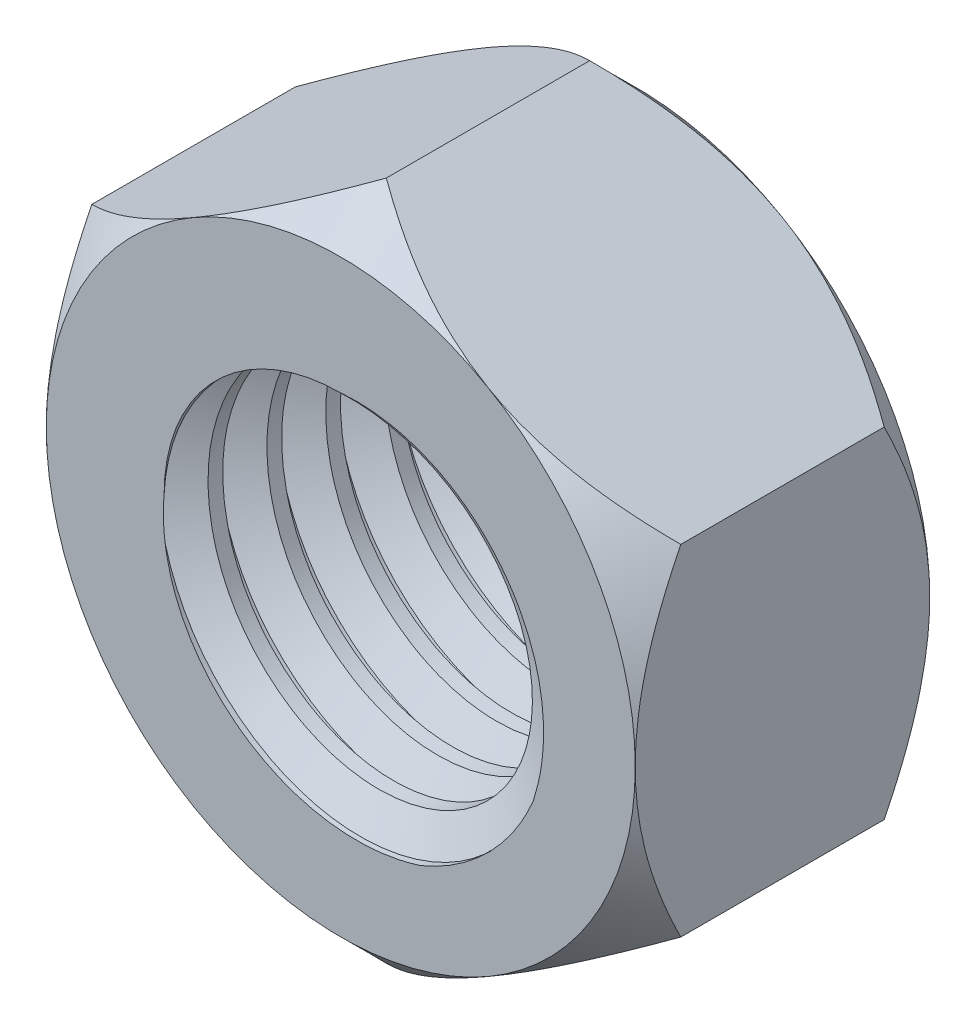
from build123d import *

# Parameters (mm, degrees)
SKETCH1_R               = 3
BOSS_EXTRUDE1_DEPTH     = 2.5
SKETCH3_OUTSIDE_W       = 70.214
SKETCH3_OUTSIDE_H       = 71.762
SKETCH3_OUTSIDE_R       = 5
CUT_EXTRUDE1_DEPTH      = 27.5
CUT_EXTRUDE1_DRAFT      = -45
MIRROR1_COPY_1_SKETCH_W = 70.214
MIRROR1_COPY_1_SKETCH_H = 71.762
MIRROR1_COPY_1_SKETCH_R = 5
MIRROR1_COPY_1_DEPTH    = 27.5
MIRROR1_COPY_1_DRAFT    = -45
SKETCH2_R               = 3
CUT_EXTRUDE2_DEPTH      = 27.5
THREAD2_PITCH           = 1


with BuildPart() as part:
    # Sketch1 → Boss-Extrude1 (new, symmetric)
    # profile 1 of 2: a face of its own
    with BuildSketch(Plane.XY):
        Polygon((-5, 2.886751346), (-5, -2.886751346), (0, -5.773502692), (5, -2.886751346), (5, 2.886751346), (0, 5.773502692), align=None)
        Circle(SKETCH1_R, mode=Mode.SUBTRACT)
    # profile 2 of 2: a face of its own
    with BuildSketch(Plane.XY):
        Circle(SKETCH1_R)
    extrude(amount=BOSS_EXTRUDE1_DEPTH, both=True)


with BuildPart() as cut_extrude1_tool:
    # Sketch3 outside → Cut-Extrude1 (with draft: the straight prism first)
    with BuildSketch(Plane.XY.offset(2.5)):
        Rectangle(SKETCH3_OUTSIDE_W, SKETCH3_OUTSIDE_H)
        Circle(SKETCH3_OUTSIDE_R, mode=Mode.SUBTRACT)
    extrude(amount=-CUT_EXTRUDE1_DEPTH)
    # Cut-Extrude1: the draft: its side faces are tilted about the plane it starts from
    cut_extrude1_sides = [cut_extrude1_tool.faces().sort_by_distance(p)[0] for p in [
        (0, -35.881, -11.25),
        (35.107, 0, -11.25),
        (0, 35.881, -11.25),
        (-35.107, 0, -11.25),
        (-5, 0, -11.25),
    ]]
    draft(cut_extrude1_sides, Plane.XY.offset(2.5), CUT_EXTRUDE1_DRAFT)


with BuildPart() as part_1:
    add(part.part)

    # Cut-Extrude1: cut by cut_extrude1_tool
    add(cut_extrude1_tool.part, mode=Mode.SUBTRACT)


with BuildPart() as mirror1_copy_1_tool:
    # Mirror1 copy 1 sketch → Mirror1 copy 1 (with draft: the straight prism first)
    with BuildSketch(Plane(origin=(0, 0, -2.5), x_dir=(1, 0, 0), z_dir=(0, 0, -1))):
        Rectangle(MIRROR1_COPY_1_SKETCH_W, MIRROR1_COPY_1_SKETCH_H)
        Circle(MIRROR1_COPY_1_SKETCH_R, mode=Mode.SUBTRACT)
    extrude(amount=-MIRROR1_COPY_1_DEPTH)
    # Mirror1 copy 1: the draft: its side faces are tilted about the plane it starts from
    mirror1_copy_1_sides = [mirror1_copy_1_tool.faces().sort_by_distance(p)[0] for p in [
        (0, -35.881, 11.25),
        (35.107, 0, 11.25),
        (0, 35.881, 11.25),
        (-35.107, 0, 11.25),
        (-5, 0, 11.25),
    ]]
    draft(mirror1_copy_1_sides, Plane(origin=(0, 0, -2.5), x_dir=(1, 0, 0), z_dir=(0, 0, -1)), MIRROR1_COPY_1_DRAFT)


with BuildPart() as part_2:
    add(part_1.part)

    # Mirror1 copy 1: cut by mirror1_copy_1_tool
    add(mirror1_copy_1_tool.part, mode=Mode.SUBTRACT)

    # Sketch2 → Cut-Extrude2 (cut)
    with BuildSketch(Plane.XY.offset(2.5)):
        Circle(SKETCH2_R)
    extrude(amount=-CUT_EXTRUDE2_DEPTH, mode=Mode.SUBTRACT)

    # Thread2: the profile of Thread Profile2 profile screwed along a right-hand helix of 7 turns, 8 arcs to a turn; built about Z, then put on its axis
    thread2_z = Axis((0, 0, 0), (0, 0, 1))
    thread2_corners = [(2.9997, 0, -0.000173205), (3.541265875, 0, 0.312499999), (3.541265875, 0, 0.437499999), (2.9997, 0, 0.750173202)]
    with BuildLine(mode=Mode.PRIVATE) as thread2_profile:
        Line(thread2_corners[0], thread2_corners[1])
        Line(thread2_corners[1], thread2_corners[2])
        Line(thread2_corners[2], thread2_corners[3])
        Line(thread2_corners[3], thread2_corners[0])
    thread2_cap = Face(thread2_profile.wire())
    thread2_turn_angles = [0, 22.5, 45, 67.5, 90, 112.5, 135, 157.5, 180, 202.5, 225, 247.5, 270, 292.5, 315, 337.5, 360]
    thread2_turn_weights = [1, 0.9238795325112867, 1, 0.9238795325112867, 1, 0.9238795325112867, 1, 0.9238795325112867, 1, 0.9238795325112867, 1, 0.9238795325112867, 1, 0.9238795325112867, 1, 0.9238795325112867, 1]
    thread2_turn_rails = [Edge.make_bspline([Vector(p[0], p[1], 0).rotate(thread2_z, thread2_turn_angles[k]) / thread2_turn_weights[k] + Vector(0, 0, p[2] + THREAD2_PITCH * thread2_turn_angles[k] / 360) for k in range(17)], [0, 0, 0, 1, 1, 2, 2, 3, 3, 4, 4, 5, 5, 6, 6, 7, 7, 8, 8, 8], 2, thread2_turn_weights) for p in thread2_corners]
    thread2_turn_sides = [Face.make_surface_from_curves(thread2_turn_rails[p[0]], thread2_turn_rails[p[1]]) for p in [(0, 1), (1, 2), (2, 3), (3, 0)]]
    thread2 = Plane(origin=(0, 0, 4.5), x_dir=(-1, 0, 0), z_dir=(0, 0, -1)) * Solid(Shell([*[p.moved(Location((0, 0, THREAD2_PITCH * i))) for i in range(7) for p in thread2_turn_sides], thread2_cap, thread2_cap.rotate(thread2_z, 2520).moved(Location((0, 0, THREAD2_PITCH * 2520 / 360)))]))
    add(thread2, mode=Mode.SUBTRACT)


solid = part_2.part
